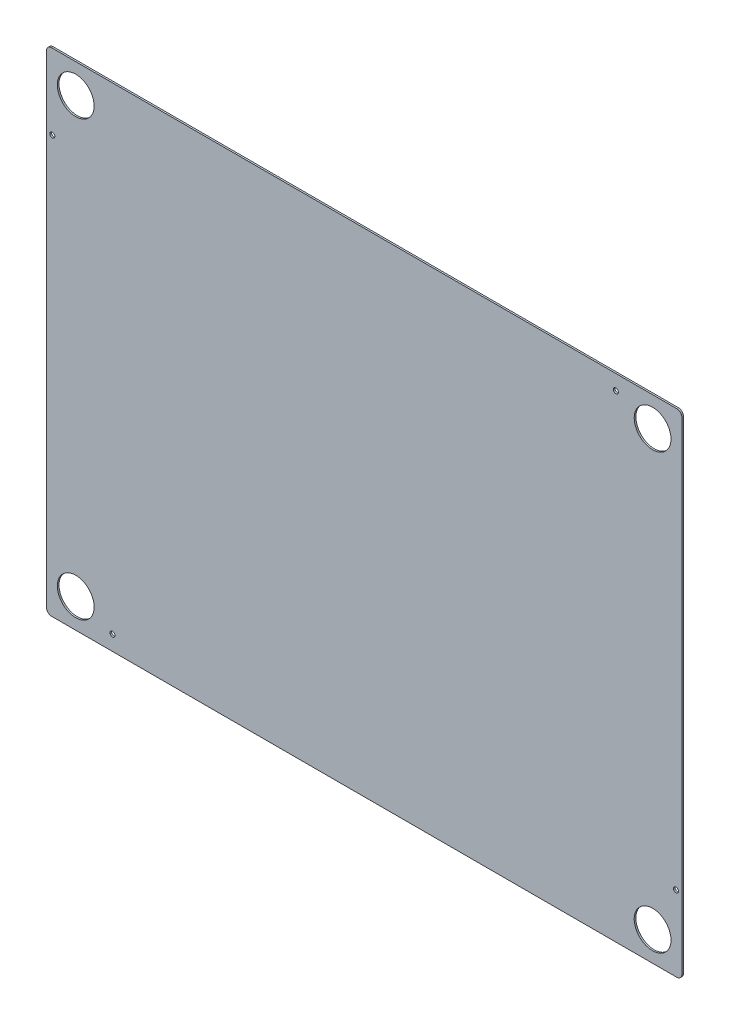
from build123d import *

# Parameters (mm, degrees)
SKETCH1_W           = 380
SKETCH1_H           = 294.5
SKETCH1_R           = 11
SKETCH1_R_2         = 1.5
BOSS_EXTRUDE1_DEPTH = 1
FILLET1_R           = 3


with BuildPart() as part:
    # Sketch1 → Boss-Extrude1 (new body)
    with BuildSketch(Plane.XY):
        Rectangle(SKETCH1_W, SKETCH1_H)
        with Locations((-172.5, 129.75)):
            Circle(SKETCH1_R, mode=Mode.SUBTRACT)
        with Locations((172.5, 129.75)):
            Circle(SKETCH1_R, mode=Mode.SUBTRACT)
        with Locations((172.5, -129.75)):
            Circle(SKETCH1_R, mode=Mode.SUBTRACT)
        with Locations((-172.5, -129.75)):
            Circle(SKETCH1_R, mode=Mode.SUBTRACT)
        with Locations((150.5, 138.25)):
            Circle(SKETCH1_R_2, mode=Mode.SUBTRACT)
        with Locations((-186.5, 102.25)):
            Circle(SKETCH1_R_2, mode=Mode.SUBTRACT)
        with Locations((-150.5, -138.25)):
            Circle(SKETCH1_R_2, mode=Mode.SUBTRACT)
        with Locations((186.5, -102.25)):
            Circle(SKETCH1_R_2, mode=Mode.SUBTRACT)
    extrude(amount=BOSS_EXTRUDE1_DEPTH)

    # Fillet1
    fillet1_edges = [part.edges().sort_by_distance(p)[0] for p in [
        (190, -147.25, 0.5),
        (-190, -147.25, 0.5),
        (-190, 147.25, 0.5),
        (190, 147.25, 0.5),
    ]]
    fillet(fillet1_edges, radius=FILLET1_R)


solid = part.part
